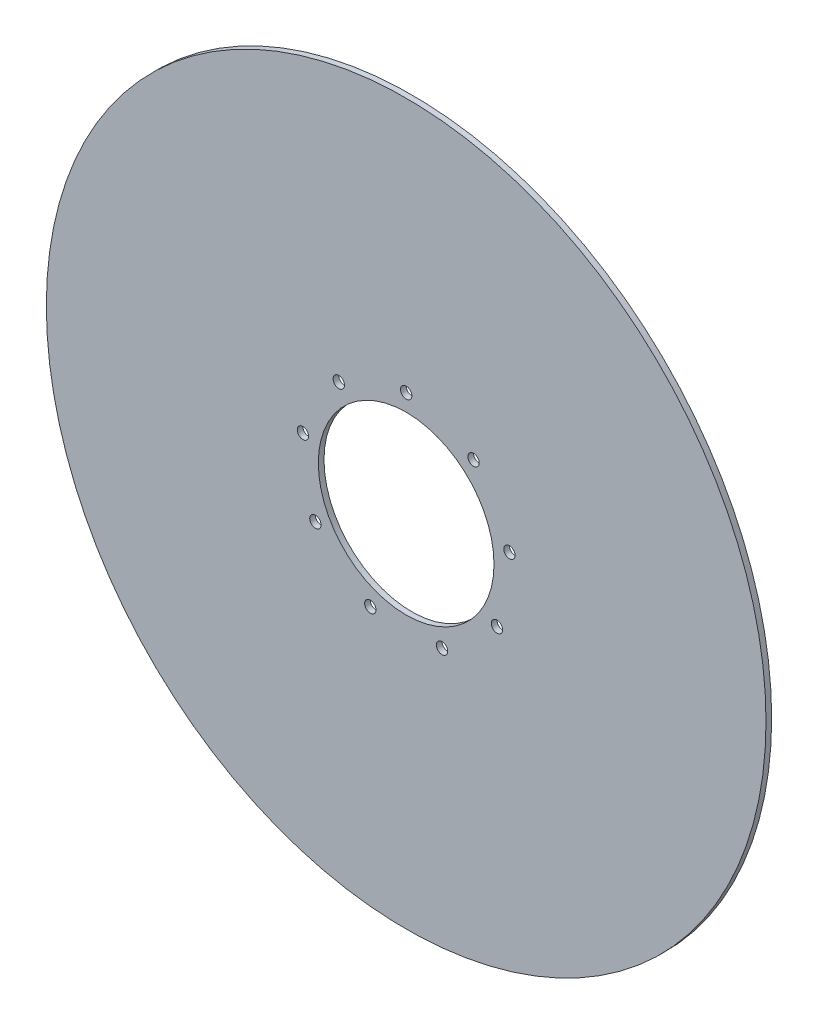
from build123d import *

# Parameters (mm, degrees)
SKETCH1_R          = 317.5
BASE_FLANGE1_DEPTH = 5
SKETCH8_R          = 77.5
CUT_EXTRUDE1_DEPTH = 10
SKETCH15_R         = 5
CUT_EXTRUDE2_DEPTH = 10
CIRPATTERN1_COUNT  = 9


# Sheet-metal steps are written as plain solids
with BuildPart() as part:
    # Sketch1 → Base-Flange1 (new body)
    with BuildSketch(Plane.XY):
        Circle(SKETCH1_R)
    extrude(amount=-BASE_FLANGE1_DEPTH)

    # Sketch8 → Cut-Extrude1 (cut)
    with BuildSketch(Plane(origin=(0, 0, -5), x_dir=(-1, 0, 0), z_dir=(0, 0, -1))):
        Circle(SKETCH8_R)
    extrude(amount=-CUT_EXTRUDE1_DEPTH, mode=Mode.SUBTRACT)

    # Sketch15 → Cut-Extrude2 (cut)
    with BuildSketch(Plane(origin=(0, 0, -5), x_dir=(-1, 0, 0), z_dir=(0, 0, -1))):
        with Locations((0, 92.5)):
            Circle(SKETCH15_R)
    cut_extrude2 = extrude(amount=-CUT_EXTRUDE2_DEPTH, mode=Mode.SUBTRACT)

    # CirPattern1: Cut-Extrude2 ×9 about axis
    cirpattern1_axis = Axis((0, 0, 0), (0, 0, 1))
    for i in range(1, CIRPATTERN1_COUNT):
        add(cut_extrude2.rotate(cirpattern1_axis, i * 360 / CIRPATTERN1_COUNT), mode=Mode.SUBTRACT)


solid = part.part
